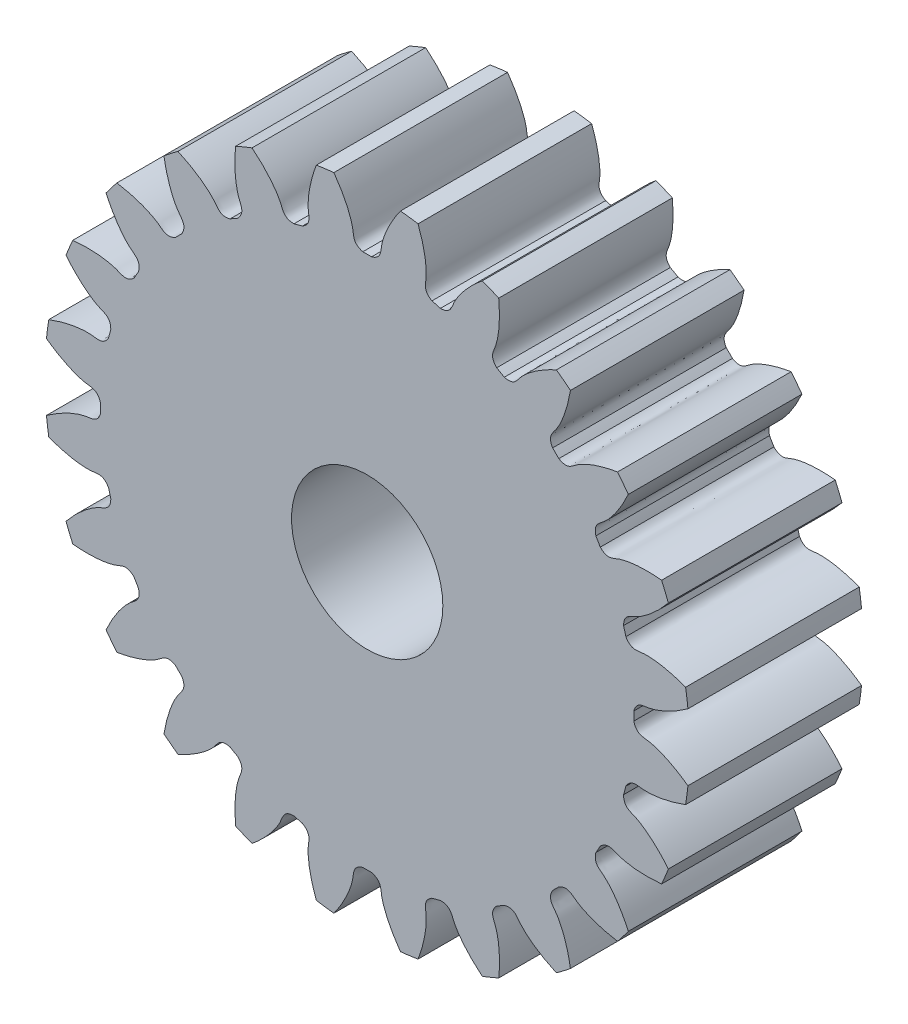
from build123d import *

# Parameters (mm, degrees)
SKETCH_1_R               = 6.5
EXTRUDE_1_DEPTH          = 3.5
CUT_EXTRUDE_1_DEPTH      = 10.836157786
PATTERN_CIRCULAR_1_COUNT = 24
CUT_EXTRUDE_2_REACH      = 11.79
SKETCH_4_R               = 1.525


with BuildPart() as part:
    # 草图1 → 凸台-拉伸1 (new body)
    with BuildSketch(Plane.XY):
        Circle(SKETCH_1_R)
    extrude(amount=EXTRUDE_1_DEPTH)

    # 草图2 → 切除-拉伸1 (cut, through all)
    with BuildSketch(Plane.XY):
        with BuildLine():
            ThreePointArc((0.088415956, 5.374272753), (0, 5.375), (-0.088415956, 5.374272753))
            add(Edge.make_bspline(
                [(-0.088415956, 5.374272753), (-0.283956108, 5.428430036), (-0.269523883, 5.557861799), (-0.293138588, 5.686342226), (-0.296517959, 5.702916521), (-0.300724242, 5.721620073), (-0.305840304, 5.742426358), (-0.311952817, 5.765305336), (-0.319146149, 5.790224685), (-0.327504211, 5.817149434), (-0.337109789, 5.846042111), (-0.348044663, 5.876862729), (-0.360389484, 5.909568827), (-0.374223721, 5.944115495), (-0.389625595, 5.980455405), (-0.406672011, 6.018538843), (-0.425438499, 6.058313744), (-0.445999145, 6.099725726), (-0.468426535, 6.142718129), (-0.492791687, 6.187232054), (-0.519163995, 6.233206399), (-0.547611171, 6.280577906), (-0.57819918, 6.329281201), (-0.610992189, 6.379248841), (-0.64605251, 6.430411359), (-0.68344054, 6.482697309), (-0.723214712, 6.53603332), (-0.765431443, 6.590344144), (-0.810145078, 6.645552705), (-0.857407842, 6.701580158), (-0.907269792, 6.758345935), (-0.959778768, 6.81576781), (-1.014980347, 6.873761948), (-1.0729178, 6.932242967), (-1.133632047, 6.991123994), (-1.197161611, 7.05031673), (-1.263542589, 7.109731505), (-1.332808587, 7.169277345), (-1.430211047, 7.249680778), (-1.505961903, 7.308439159), (-1.55780976, 7.347058965)],
                knots=[0, 0, 0, 0, 0.143961355, 0.149818462, 0.156576662, 0.164235955, 0.172796342, 0.182257821, 0.192620395, 0.203884061, 0.216048821, 0.229114674, 0.24308162, 0.25794966, 0.273718793, 0.290389019, 0.307960339, 0.326432751, 0.345806258, 0.366080857, 0.38725655, 0.409333336, 0.432311215, 0.456190188, 0.480970254, 0.506651413, 0.533233666, 0.560717012, 0.589101451, 0.618386984, 0.64857361, 0.679661329, 0.711650141, 0.744540047, 0.778331046, 0.813023138, 0.848616324, 0.885110603, 0.922505975, 1, 1, 1, 1], degree=3))
            ThreePointArc((-1.55780976, 7.347058965), (0, 7.510395907), (1.55780976, 7.347058965))
            add(Edge.make_bspline(
                [(0.088415956, 5.374272753), (0.283956108, 5.428430036), (0.269523883, 5.557861799), (0.293138588, 5.686342226), (0.296517959, 5.702916521), (0.300724242, 5.721620073), (0.305840304, 5.742426358), (0.311952817, 5.765305336), (0.319146149, 5.790224685), (0.327504211, 5.817149434), (0.337109789, 5.846042111), (0.348044663, 5.876862729), (0.360389484, 5.909568827), (0.374223721, 5.944115495), (0.389625595, 5.980455405), (0.406672011, 6.018538843), (0.425438499, 6.058313744), (0.445999145, 6.099725726), (0.468426535, 6.142718129), (0.492791687, 6.187232054), (0.519163995, 6.233206399), (0.547611171, 6.280577906), (0.57819918, 6.329281201), (0.610992189, 6.379248841), (0.64605251, 6.430411359), (0.68344054, 6.482697309), (0.723214712, 6.53603332), (0.765431443, 6.590344144), (0.810145078, 6.645552705), (0.857407842, 6.701580158), (0.907269792, 6.758345935), (0.959778768, 6.81576781), (1.014980347, 6.873761948), (1.0729178, 6.932242967), (1.133632047, 6.991123994), (1.197161611, 7.05031673), (1.263542589, 7.109731505), (1.332808587, 7.169277345), (1.430211047, 7.249680778), (1.505961903, 7.308439159), (1.55780976, 7.347058965)],
                knots=[0, 0, 0, 0, 0.143961355, 0.149818462, 0.156576662, 0.164235955, 0.172796342, 0.182257821, 0.192620395, 0.203884061, 0.216048821, 0.229114674, 0.24308162, 0.25794966, 0.273718793, 0.290389019, 0.307960339, 0.326432751, 0.345806258, 0.366080857, 0.38725655, 0.409333336, 0.432311215, 0.456190188, 0.480970254, 0.506651413, 0.533233666, 0.560717012, 0.589101451, 0.618386984, 0.64857361, 0.679661329, 0.711650141, 0.744540047, 0.778331046, 0.813023138, 0.848616324, 0.885110603, 0.922505975, 1, 1, 1, 1], degree=3))
        make_face()
    cut_extrude_1 = extrude(amount=CUT_EXTRUDE_1_DEPTH, mode=Mode.SUBTRACT)

    # 阵列(圆周)1: 切除-拉伸1 ×24 about axis
    pattern_circular_1_axis = Axis((0, 0, 3.5), (0, 0, -1))
    for i in range(1, PATTERN_CIRCULAR_1_COUNT):
        add(cut_extrude_1.rotate(pattern_circular_1_axis, i * 360 / PATTERN_CIRCULAR_1_COUNT), mode=Mode.SUBTRACT)

    # 草图4 → 切除-拉伸2 (cut, up to next)
    with BuildSketch(Plane.XY.offset(3.5), mode=Mode.PRIVATE) as cut_extrude_2_sk1:
        Circle(SKETCH_4_R)
    cut_extrude_2_tool1 = extrude(cut_extrude_2_sk1.sketch, amount=-CUT_EXTRUDE_2_REACH, mode=Mode.PRIVATE) & part.part
    add(cut_extrude_2_tool1.solids().sort_by_distance((0, 0, 3.5))[0], mode=Mode.SUBTRACT)


solid = part.part
